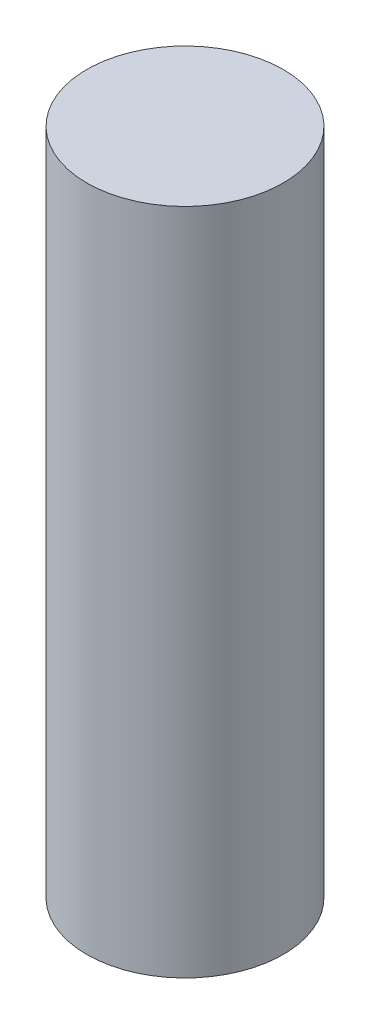
from build123d import *

# Parameters (mm, degrees)
SKETCH1_R           = 3
BOSS_EXTRUDE1_DEPTH = 20.3962


with BuildPart() as part:
    # Sketch1 → Boss-Extrude1 (new body)
    with BuildSketch(Plane(origin=(0, 0, 0), x_dir=(1, 0, 0), z_dir=(0, 1, 0))):
        Circle(SKETCH1_R)
    extrude(amount=BOSS_EXTRUDE1_DEPTH)


solid = part.part
